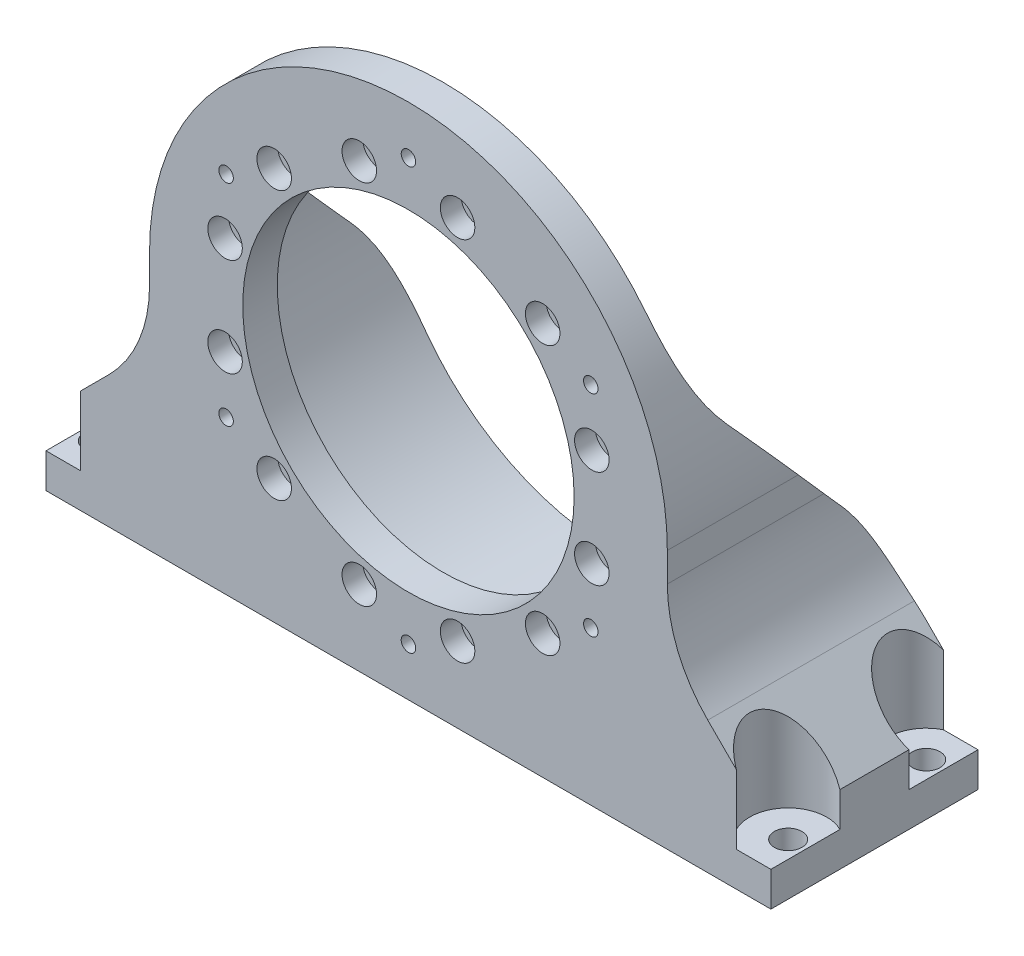
from build123d import *

# Parameters (mm, degrees)
SKETCH1_R                       = 48
BOSS_EXTRUDE1_DEPTH             = 10
SKETCH2_R                       = 2.1
CUT_EXTRUDE1_DEPTH              = 107.536379
SKETCH3_R                       = 1.6
CUT_EXTRUDE2_DEPTH              = 107.536379
SKETCH4_R                       = 2.75
CUT_EXTRUDE3_DEPTH              = 6.5
SKETCH5_R                       = 5
CUT_EXTRUDE4_DEPTH              = 6
BOSS_EXTRUDE2_DEPTH             = 50
BOSS_EXTRUDE2_DIRECTION_2_REACH = 108.536
CUT_EXTRUDE5_DEPTH              = 139.383525
CUT_EXTRUDE5_DEPTH_BACK         = 139.383525
CUT_EXTRUDE6_DEPTH              = 190.802529
CUT_EXTRUDE6_DEPTH_BACK         = 190.802529
SKETCH8_R                       = 4
CUT_EXTRUDE7_START              = -10
SKETCH9_R                       = 11.18034
CUT_EXTRUDE7_DEPTH              = 180.802529
FILLET1_R                       = 40
SKETCH10_R                      = 5
BOSS_EXTRUDE3_DEPTH             = 0.2


with BuildPart() as part:
    # Sketch1 → Boss-Extrude1 (new body)
    with BuildSketch(Plane.XY):
        with BuildLine():
            Line((-75, 0), (-75, -75))
            Line((-75, -75), (75, -75))
            Line((75, -75), (75, 0))
            ThreePointArc((75, 0), (0, 75), (-75, 0))
        make_face()
        Circle(SKETCH1_R, mode=Mode.SUBTRACT)
    extrude(amount=BOSS_EXTRUDE1_DEPTH)

    # Sketch2 → Cut-Extrude1 (cut, through all)
    with BuildSketch(Plane.XY.offset(10)):
        with Locations((0, 61)):
            Circle(SKETCH2_R)
        with Locations((52.82755, 30.5)):
            Circle(SKETCH2_R)
        with Locations((52.82755, -30.5)):
            Circle(SKETCH2_R)
        with Locations((0, -61)):
            Circle(SKETCH2_R)
        with Locations((-52.82755, -30.5)):
            Circle(SKETCH2_R)
        with Locations((-52.82755, 30.5)):
            Circle(SKETCH2_R)
    extrude(amount=-CUT_EXTRUDE1_DEPTH, mode=Mode.SUBTRACT)

    # Sketch3 → Cut-Extrude2 (cut, through all)
    with BuildSketch(Plane.XY.offset(10)):
        with Locations((14.235047, 53.12592)):
            Circle(SKETCH3_R)
        with Locations((38.890873, 38.890873)):
            Circle(SKETCH3_R)
        with Locations((53.12592, 14.235047)):
            Circle(SKETCH3_R)
        with Locations((53.12592, -14.235047)):
            Circle(SKETCH3_R)
        with Locations((38.890873, -38.890873)):
            Circle(SKETCH3_R)
        with Locations((14.235047, -53.12592)):
            Circle(SKETCH3_R)
        with Locations((-14.235047, -53.12592)):
            Circle(SKETCH3_R)
        with Locations((-38.890873, -38.890873)):
            Circle(SKETCH3_R)
        with Locations((-53.12592, -14.235047)):
            Circle(SKETCH3_R)
        with Locations((-53.12592, 14.235047)):
            Circle(SKETCH3_R)
        with Locations((-38.890873, 38.890873)):
            Circle(SKETCH3_R)
        with Locations((-14.235047, 53.12592)):
            Circle(SKETCH3_R)
    extrude(amount=-CUT_EXTRUDE2_DEPTH, mode=Mode.SUBTRACT)

    # Sketch4 → Cut-Extrude3 (cut)
    with BuildSketch(Plane(origin=(0, 0, 0), x_dir=(-1, 0, 0), z_dir=(0, 0, -1))):
        with Locations((-52.82755, 30.5)):
            Circle(SKETCH4_R)
        with Locations((0, 61)):
            Circle(SKETCH4_R)
        with Locations((52.82755, 30.5)):
            Circle(SKETCH4_R)
        with Locations((52.82755, -30.5)):
            Circle(SKETCH4_R)
        with Locations((0, -61)):
            Circle(SKETCH4_R)
        with Locations((-52.82755, -30.5)):
            Circle(SKETCH4_R)
    extrude(amount=-CUT_EXTRUDE3_DEPTH, mode=Mode.SUBTRACT)

    # Sketch5 → Cut-Extrude4 (cut)
    with BuildSketch(Plane.XY.offset(10)):
        with Locations((14.235047, 53.12592)):
            Circle(SKETCH5_R)
        with Locations((-14.235047, 53.12592)):
            Circle(SKETCH5_R)
        with Locations((38.890873, 38.890873)):
            Circle(SKETCH5_R)
        with Locations((53.12592, 14.235047)):
            Circle(SKETCH5_R)
        with Locations((53.12592, -14.235047)):
            Circle(SKETCH5_R)
        with Locations((38.890873, -38.890873)):
            Circle(SKETCH5_R)
        with Locations((14.235047, -53.12592)):
            Circle(SKETCH5_R)
        with Locations((-14.235047, -53.12592)):
            Circle(SKETCH5_R)
        with Locations((-38.890873, -38.890873)):
            Circle(SKETCH5_R)
        with Locations((-53.12592, -14.235047)):
            Circle(SKETCH5_R)
        with Locations((-53.12592, 14.235047)):
            Circle(SKETCH5_R)
        with Locations((-38.890873, 38.890873)):
            Circle(SKETCH5_R)
    extrude(amount=-CUT_EXTRUDE4_DEPTH, mode=Mode.SUBTRACT)

    # Sketch6 → Boss-Extrude2 (add)
    with BuildSketch(Plane(origin=(0, 0, 0), x_dir=(-1, 0, 0), z_dir=(0, 0, -1))):
        with BuildLine():
            Line((-75, -25), (-105, -55))
            Line((-105, -55), (-105, -75))
            Line((-105, -75), (-75, -75))
            Line((-75, -75), (75, -75))
            Line((75, -75), (105, -75))
            Line((105, -75), (105, -55))
            Line((105, -55), (75, -25))
            Line((75, -25), (75, 0))
            ThreePointArc((75, 0), (73.229093, 16.201852), (68, 31.638584))
            Line((68, 31.638584), (60.191362, 31.638584))
            ThreePointArc((60.191362, 31.638584), (66.018984, 16.293978), (68, 0))
            ThreePointArc((68, 0), (0, -68), (-68, 0))
            ThreePointArc((-68, 0), (-66.018984, 16.293978), (-60.191362, 31.638584))
            Line((-60.191362, 31.638584), (-68, 31.638584))
            ThreePointArc((-68, 31.638584), (-73.229093, 16.201852), (-75, 0))
            Line((-75, 0), (-75, -25))
        make_face()
    extrude(amount=BOSS_EXTRUDE2_DEPTH)

    # Boss-Extrude2 direction 2: up to this face of the body (flat: up to its plane)
    boss_extrude2_direction_2_end = Plane(part.part.faces().sort_by_distance((-72.87868, -37.5, 10))[0])
    # Sketch6 → Boss-Extrude2 direction 2 (add, up to the picked face)
    with BuildSketch(Plane(origin=(0, 0, 0), x_dir=(-1, 0, 0), z_dir=(0, 0, -1)), mode=Mode.PRIVATE) as boss_extrude2_direction_2_sk1:
        with BuildLine():
            Line((-75, -25), (-105, -55))
            Line((-105, -55), (-105, -75))
            Line((-105, -75), (-75, -75))
            Line((-75, -75), (75, -75))
            Line((75, -75), (105, -75))
            Line((105, -75), (105, -55))
            Line((105, -55), (75, -25))
            Line((75, -25), (75, 0))
            ThreePointArc((75, 0), (73.229093, 16.201852), (68, 31.638584))
            Line((68, 31.638584), (60.191362, 31.638584))
            ThreePointArc((60.191362, 31.638584), (66.018984, 16.293978), (68, 0))
            ThreePointArc((68, 0), (0, -68), (-68, 0))
            ThreePointArc((-68, 0), (-66.018984, 16.293978), (-60.191362, 31.638584))
            Line((-60.191362, 31.638584), (-68, 31.638584))
            ThreePointArc((-68, 31.638584), (-73.229093, 16.201852), (-75, 0))
            Line((-75, 0), (-75, -25))
        make_face()
    boss_extrude2_direction_2_tool1 = split(extrude(boss_extrude2_direction_2_sk1.sketch, amount=-BOSS_EXTRUDE2_DIRECTION_2_REACH, mode=Mode.PRIVATE), bisect_by=boss_extrude2_direction_2_end, keep=Keep.BOTH, mode=Mode.PRIVATE)
    add(boss_extrude2_direction_2_tool1.solids().sort_by(Axis((68.305615, 16.858335, 0), (0, 0, 1)))[0])

    # Sketch7 → Cut-Extrude5 (cut, two sides: drawn at the far end of the back side and taken through both)
    with BuildSketch(Plane(origin=(0, 0, 0), x_dir=(0, 0, -1), z_dir=(1, 0, 0)).offset(-CUT_EXTRUDE5_DEPTH_BACK)):
        Polygon((0, 31.638584), (50, -25), (50, 31.638584), align=None)
    extrude(amount=CUT_EXTRUDE5_DEPTH + CUT_EXTRUDE5_DEPTH_BACK, mode=Mode.SUBTRACT)

    # Sketch8 → Cut-Extrude6 (cut, two sides: drawn at the far end of the back side and taken through both)
    with BuildSketch(Plane.XZ.offset(75).offset(-CUT_EXTRUDE6_DEPTH_BACK)):
        with Locations(Location((-100, 0, 0), (0, 0, 270))):
            Circle(SKETCH8_R)
        with Locations(Location((-100, -40, 0), (0, 0, 270))):
            Circle(SKETCH8_R)
        with Locations((100, -40)):
            Circle(SKETCH8_R)
        with Locations((100, 0)):
            Circle(SKETCH8_R)
    extrude(amount=CUT_EXTRUDE6_DEPTH + CUT_EXTRUDE6_DEPTH_BACK, mode=Mode.SUBTRACT)

    # Sketch9 → Cut-Extrude7 (cut, through all)
    with BuildSketch(Plane.XZ.offset(75).offset(CUT_EXTRUDE7_START)):
        with Locations((-100, 0)):
            Circle(SKETCH9_R)
        with Locations((-100, -40)):
            Circle(SKETCH9_R)
        with Locations((100, -40)):
            Circle(SKETCH9_R)
        with Locations((100, 0)):
            Circle(SKETCH9_R)
    extrude(amount=-CUT_EXTRUDE7_DEPTH, mode=Mode.SUBTRACT)

    # Fillet1
    # the kernel refuses this fillet: 40 mm, written as the material it adds along each edge
    with BuildSketch(Plane(origin=(-75, -25, -50), x_dir=(0, 1, 0), z_dir=(0, 0, 1))) as fillet1_piece_1_section:
        with BuildLine():
            CenterArc((FILLET1_R * 0.414213562373, FILLET1_R), FILLET1_R, 225, 45)
            Line((-FILLET1_R * 0.292893218813, FILLET1_R * 0.292893218813), (0, 0))
            Line((0, 0), (FILLET1_R * 0.414213562373, 0))
        make_face()
    fillet1_piece_1 = extrude(amount=60, mode=Mode.PRIVATE)
    fillet1_piece_1 = split(fillet1_piece_1, bisect_by=Plane(origin=(-77.587391, -9.143686, -36.002198), z_dir=(0, -0.661806023276728, 0.7496751213389992)), keep=Keep.TOP, mode=Mode.PRIVATE)
    add(fillet1_piece_1)
    with BuildSketch(Plane(origin=(75, -25, 10), x_dir=(0, 1, 0), z_dir=(0, 0, -1))) as fillet1_piece_2_section:
        with BuildLine():
            CenterArc((FILLET1_R * 0.414213562373, FILLET1_R), FILLET1_R, 225, 45)
            Line((-FILLET1_R * 0.292893218813, FILLET1_R * 0.292893218813), (0, 0))
            Line((0, 0), (FILLET1_R * 0.414213562373, 0))
        make_face()
    fillet1_piece_2 = extrude(amount=60, mode=Mode.PRIVATE)
    fillet1_piece_2 = split(fillet1_piece_2, bisect_by=Plane(origin=(77.587391, -9.143686, -36.002198), z_dir=(0, -0.661806023276728, 0.7496751213389992)), keep=Keep.TOP, mode=Mode.PRIVATE)
    add(fillet1_piece_2)
    with BuildSketch(Plane(origin=(-105.824509, 31.638584, 0), x_dir=(0, -0.749675121338999, -0.661806023276728), z_dir=(1, 0, 0))) as fillet1_piece_3_section:
        with BuildLine():
            CenterArc((FILLET1_R * 0.378245089734, FILLET1_R), FILLET1_R, 228.562244, 41.437756)
            Line((-FILLET1_R * 0.283560933542, FILLET1_R * 0.250324878661), (0, 0))
            Line((0, 0), (FILLET1_R * 0.378245089734, 0))
        make_face()
    fillet1_piece_3 = extrude(amount=83.457656, mode=Mode.PRIVATE)
    fillet1_piece_3 = fillet1_piece_3 - Plane(origin=(0, 0, -1.977931), x_dir=(1, 0, 0), z_dir=(0, 0, 1)) * Cylinder(68, 228, mode=Mode.PRIVATE)
    fillet1_piece_3 = fillet1_piece_3 & Plane(origin=(0, 0, -1.977931), x_dir=(1, 0, 0), z_dir=(0, 0, -1)) * Cylinder(75, 228, mode=Mode.PRIVATE)
    add(fillet1_piece_3)
    with BuildSketch(Plane(origin=(22.366853, 31.638584, 0), x_dir=(0, -0.749675121338999, -0.661806023276728), z_dir=(1, 0, 0))) as fillet1_piece_4_section:
        with BuildLine():
            CenterArc((FILLET1_R * 0.378245089734, FILLET1_R), FILLET1_R, 228.562244, 41.437756)
            Line((-FILLET1_R * 0.283560933542, FILLET1_R * 0.250324878661), (0, 0))
            Line((0, 0), (FILLET1_R * 0.378245089734, 0))
        make_face()
    fillet1_piece_4 = extrude(amount=83.457656, mode=Mode.PRIVATE)
    fillet1_piece_4 = fillet1_piece_4 - Plane(origin=(0, 0, -1.977928), x_dir=(1, 0, 0), z_dir=(0, 0, 1)) * Cylinder(68, 228, mode=Mode.PRIVATE)
    fillet1_piece_4 = fillet1_piece_4 & Plane(origin=(0, 0, -1.977928), x_dir=(1, 0, 0), z_dir=(0, 0, -1)) * Cylinder(75, 228, mode=Mode.PRIVATE)
    add(fillet1_piece_4)
    # the kernel refuses this fillet: 40 mm, written as the material it takes off along each edge
    with BuildSketch(Plane(origin=(-25.413138, -25, -50), x_dir=(-8.15223520869354e-15, 0.749675121338999, 0.661806023276728), z_dir=(-1, 0, 0))) as fillet1_2_piece_1:
        with BuildLine():
            CenterArc((FILLET1_R * 0.378245089734, -FILLET1_R), FILLET1_R, 90, 41.437756)
            Line((-FILLET1_R * 0.283560933542, -FILLET1_R * 0.250324878661), (0, 0))
            Line((0, 0), (FILLET1_R * 0.378245089734, 0))
        make_face()
    extrude(amount=91.004182, mode=Mode.SUBTRACT)
    with BuildSketch(Plane(origin=(25.413138, -25, -50), x_dir=(8.84604246049806e-15, 0.749675121338999, 0.661806023276728), z_dir=(1, 0, 0))) as fillet1_2_piece_2:
        with BuildLine():
            CenterArc((FILLET1_R * 0.378245089734, FILLET1_R), FILLET1_R, 228.562244, 41.437756)
            Line((-FILLET1_R * 0.283560933542, FILLET1_R * 0.250324878661), (0, 0))
            Line((0, 0), (FILLET1_R * 0.378245089734, 0))
        make_face()
    extrude(amount=91.004182, mode=Mode.SUBTRACT)

    # Sketch10 → Boss-Extrude3 (add)
    with BuildSketch(Plane.XY.offset(4)):
        with Locations((14.235047, 53.12592)):
            Circle(SKETCH10_R)
        with Locations((-14.235047, 53.12592)):
            Circle(SKETCH10_R)
        with Locations((38.890873, 38.890873)):
            Circle(SKETCH10_R)
        with Locations((53.12592, 14.235047)):
            Circle(SKETCH10_R)
        with Locations((53.12592, -14.235047)):
            Circle(SKETCH10_R)
        with Locations((38.890873, -38.890873)):
            Circle(SKETCH10_R)
        with Locations((14.235047, -53.12592)):
            Circle(SKETCH10_R)
        with Locations((-14.235047, -53.12592)):
            Circle(SKETCH10_R)
        with Locations((-38.890873, -38.890873)):
            Circle(SKETCH10_R)
        with Locations((-53.12592, -14.235047)):
            Circle(SKETCH10_R)
        with Locations((-53.12592, 14.235047)):
            Circle(SKETCH10_R)
        with Locations((-38.890873, 38.890873)):
            Circle(SKETCH10_R)
    extrude(amount=-BOSS_EXTRUDE3_DEPTH)


solid = part.part
